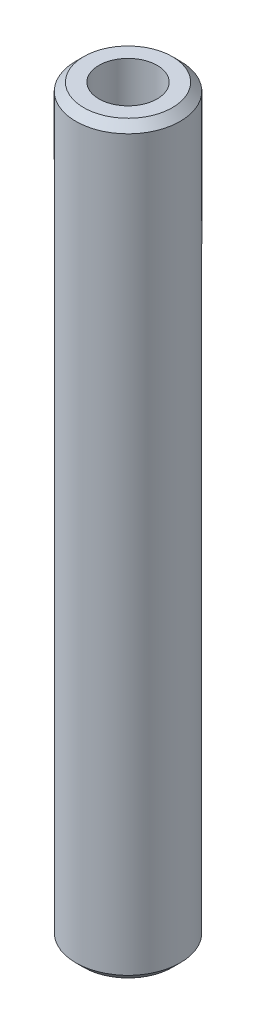
from build123d import *

# Parameters (mm, degrees)
SKETCH1_R           = 10
BOSS_EXTRUDE1_DEPTH = 142.672714757
SKETCH2_R           = 5.581289943
CUT_EXTRUDE1_DEPTH  = 144.37190637
CHAMFER1_SIZE       = 1.513721111


with BuildPart() as part:
    # Sketch1 → Boss-Extrude1 (new body)
    with BuildSketch(Plane(origin=(0, 0, 0), x_dir=(1, 0, 0), z_dir=(0, 1, 0))):
        Circle(SKETCH1_R)
    extrude(amount=BOSS_EXTRUDE1_DEPTH)

    # Sketch2 → Cut-Extrude1 (cut, through all)
    with BuildSketch(Plane(origin=(0, 0, 0), x_dir=(1, 0, 0), z_dir=(0, 1, 0))):
        Circle(SKETCH2_R)
    extrude(amount=CUT_EXTRUDE1_DEPTH, mode=Mode.SUBTRACT)

    # Chamfer1
    chamfer1_edges = [part.edges().sort_by_distance(p)[0] for p in [
        (-10, 142.672714757, 0),
        (-10, 0, 0),
    ]]
    chamfer(chamfer1_edges, length=CHAMFER1_SIZE)


solid = part.part
